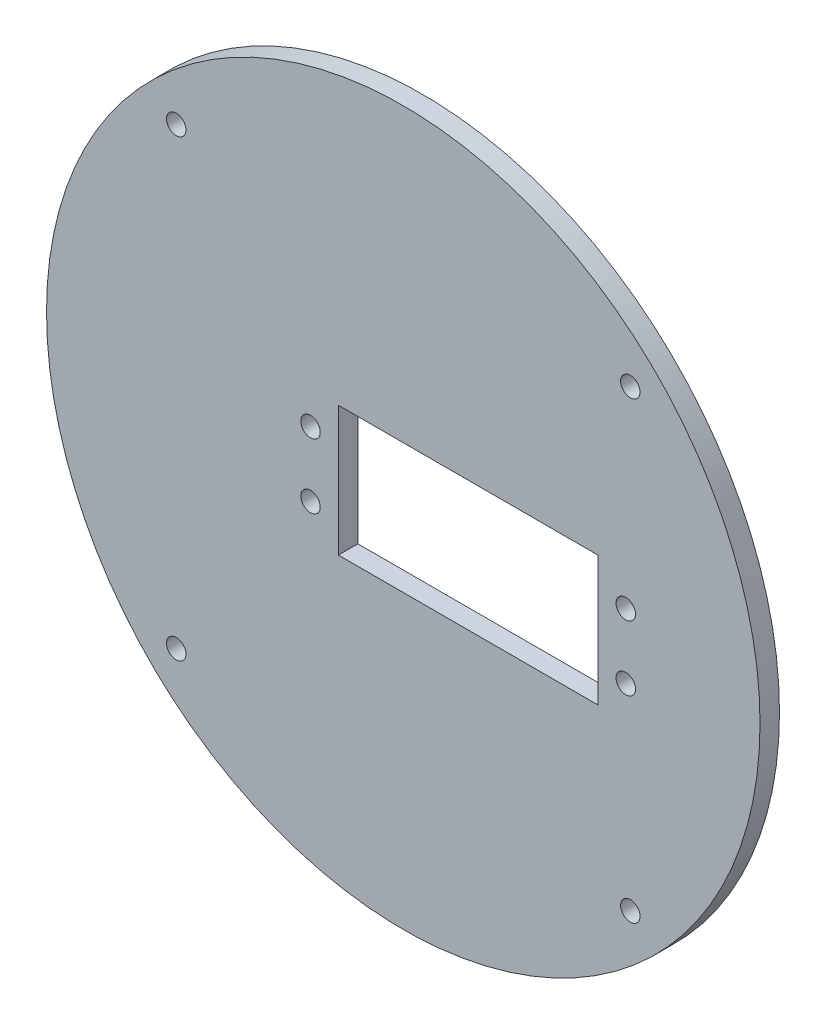
from build123d import *

# Parameters (mm, degrees)
SKETCH_1_R      = 55
SKETCH_1_R_2    = 1.5
SKETCH_1_W      = 40
SKETCH_1_H      = 20
EXTRUDE_2_DEPTH = 3


with BuildPart() as part:
    # 草图1 → 凸台-拉伸2 (new body)
    with BuildSketch(Plane.XY):
        Circle(SKETCH_1_R)
        with Locations((-35.001785669, -35.001785669)):
            Circle(SKETCH_1_R_2, mode=Mode.SUBTRACT)
        with Locations((35.001785669, -35.001785669)):
            Circle(SKETCH_1_R_2, mode=Mode.SUBTRACT)
        with Locations((35.001785669, 35.001785669)):
            Circle(SKETCH_1_R_2, mode=Mode.SUBTRACT)
        with Locations((-35.001785669, 35.001785669)):
            Circle(SKETCH_1_R_2, mode=Mode.SUBTRACT)
        with Locations((34.3, 5)):
            Circle(SKETCH_1_R_2, mode=Mode.SUBTRACT)
        with Locations((10, 0)):
            Rectangle(SKETCH_1_W, SKETCH_1_H, mode=Mode.SUBTRACT)
        with Locations((-14.3, 5)):
            Circle(SKETCH_1_R_2, mode=Mode.SUBTRACT)
        with Locations((-14.3, -5)):
            Circle(SKETCH_1_R_2, mode=Mode.SUBTRACT)
        with Locations((34.3, -5)):
            Circle(SKETCH_1_R_2, mode=Mode.SUBTRACT)
    extrude(amount=EXTRUDE_2_DEPTH)


solid = part.part
